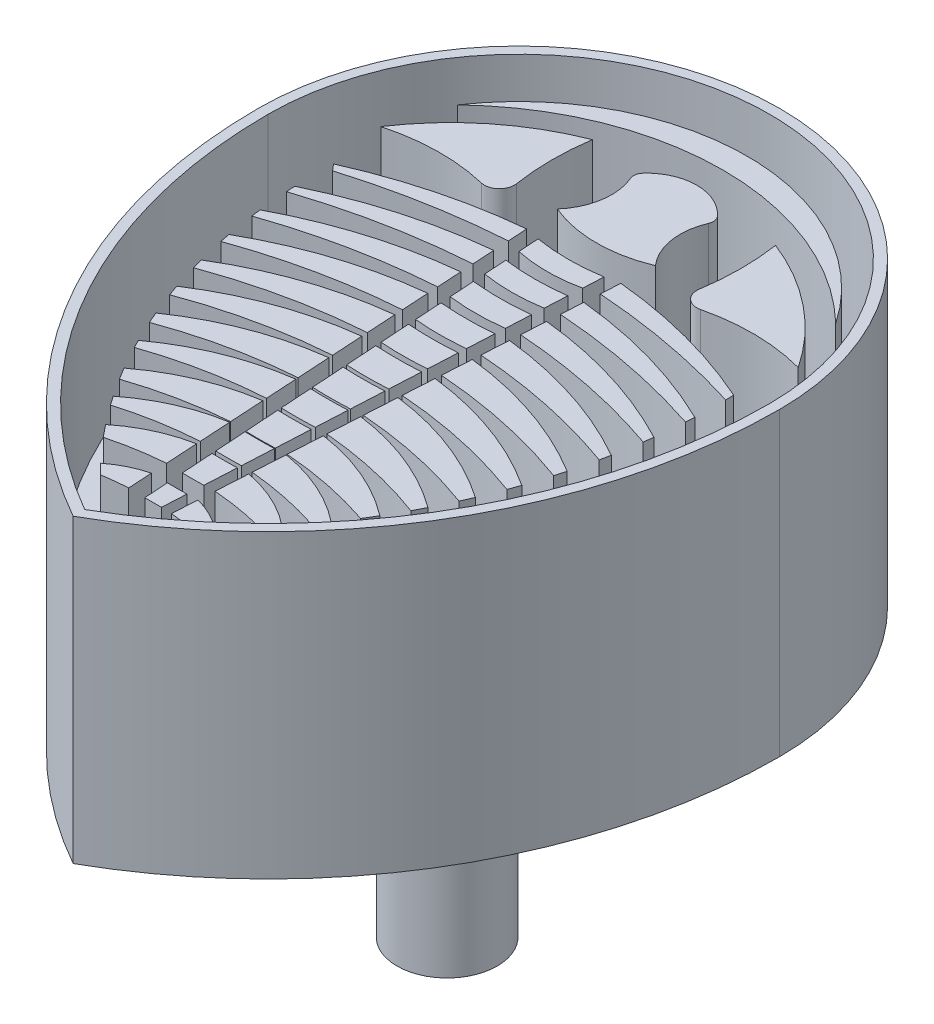
from build123d import *

# Parameters (mm, degrees)
P_IDAT_VYSUNUT_M1_DEPTH     = 3
P_IDAT_VYSUNUT_M2_DEPTH     = 2.5
VYSUNOUT_TENKOST_NN_1_DEPTH = 3
SKICA4_R                    = 1
P_IDAT_VYSUNUT_M3_DEPTH     = 5
M_TKO2_SCALE                = 10


with BuildPart() as part:
    # Skica1 → Přidat vysunutím1 (new body)
    with BuildSketch(Plane(origin=(0, 0, 0), x_dir=(1, 0, 0), z_dir=(0, 1, 0))):
        with BuildLine():
            ThreePointArc((5, 0), (0, 5), (-5, 0))
            ThreePointArc((-5, 0), (-3.660254038, -5), (0, -8.660254038))
            ThreePointArc((0, -8.660254038), (3.660254038, -5), (5, 0))
        make_face()
    extrude(amount=-P_IDAT_VYSUNUT_M1_DEPTH)

    # Skica2 → Přidat vysunutím2 (add)
    with BuildSketch(Plane(origin=(0, 0, 0), x_dir=(1, 0, 0), z_dir=(0, 1, 0))):
        with BuildLine():
            Line((-0.916308941, 0.705415762), (-0.939566009, 1.094601969))
            ThreePointArc((-0.939566009, 1.094601969), (-2.496070066, 0.816540474), (-3.987598771, 0.291787966))
            ThreePointArc((-3.987598771, 0.291787966), (-3.93376434, 0.226933977), (-3.878875249, 0.162970131))
            ThreePointArc((-3.878875249, 0.162970131), (-2.412884098, 0.517710206), (-0.916308941, 0.705415762))
        make_face()
        with BuildLine():
            ThreePointArc((3.996049018, 0.288019105), (2.500543522, 0.815361092), (0.939566009, 1.094601969))
            Line((0.939566009, 1.094601969), (0.916308941, 0.705415762))
            ThreePointArc((0.916308941, 0.705415762), (2.474795846, 0.50622373), (3.999244676, 0.125941382))
            ThreePointArc((3.999244676, 0.125941382), (3.997959641, 0.206986411), (3.996049018, 0.288019105))
        make_face()
        with BuildLine():
            Line((-0.435047938, -7.348056278), (-0.463870567, -6.865735387))
            ThreePointArc((-0.463870567, -6.865735387), (-0.820283032, -6.998144282), (-1.142178643, -7.200493427))
            ThreePointArc((-1.142178643, -7.200493427), (-1.044053725, -7.303235817), (-0.944547646, -7.404641136))
            ThreePointArc((-0.944547646, -7.404641136), (-0.69047942, -7.370211218), (-0.435047938, -7.348056278))
        make_face()
        with BuildLine():
            Line((-0.48311443, -6.543706568), (-0.52103385, -5.909159033))
            ThreePointArc((-0.52103385, -5.909159033), (-1.175976189, -6.119175526), (-1.759961506, -6.482517714))
            ThreePointArc((-1.759961506, -6.482517714), (-1.662000146, -6.605433643), (-1.56220985, -6.726869431))
            ThreePointArc((-1.56220985, -6.726869431), (-1.026754601, -6.611177456), (-0.48311443, -6.543706568))
        make_face()
        with BuildLine():
            ThreePointArc((1.759961506, -6.482517714), (1.175976189, -6.119175526), (0.52103385, -5.909159033))
            Line((0.52103385, -5.909159033), (0.48311443, -6.543706568))
            ThreePointArc((0.48311443, -6.543706568), (1.026754601, -6.611177456), (1.56220985, -6.726869431))
            ThreePointArc((1.56220985, -6.726869431), (1.662000146, -6.605433643), (1.759961506, -6.482517714))
        make_face()
        with BuildLine():
            Line((-0.525801188, -5.829381897), (-0.563062791, -5.205842323))
            ThreePointArc((-0.563062791, -5.205842323), (-1.413947855, -5.458574562), (-2.173892527, -5.917228103))
            ThreePointArc((-2.173892527, -5.917228103), (-2.111177401, -6.008129807), (-2.04750967, -6.098366866))
            ThreePointArc((-2.04750967, -6.098366866), (-1.294271561, -5.920788208), (-0.525801188, -5.829381897))
        make_face()
        with BuildLine():
            Line((-0.564221505, -5.186452286), (-0.605000226, -4.504056891))
            ThreePointArc((-0.605000226, -4.504056891), (-1.630072172, -4.78948348), (-2.550516325, -5.323359302))
            ThreePointArc((-2.550516325, -5.323359302), (-2.47902439, -5.443080103), (-2.405948876, -5.561840938))
            ThreePointArc((-2.405948876, -5.561840938), (-1.496899189, -5.31618491), (-0.564221505, -5.186452286))
        make_face()
        with BuildLine():
            ThreePointArc((2.550516325, -5.323359302), (1.630072172, -4.78948348), (0.605000226, -4.504056891))
            Line((0.605000226, -4.504056891), (0.564221505, -5.186452286))
            ThreePointArc((0.564221505, -5.186452286), (1.496899189, -5.31618491), (2.405948876, -5.561840938))
            ThreePointArc((2.405948876, -5.561840938), (2.47902439, -5.443080103), (2.550516325, -5.323359302))
        make_face()
        with BuildLine():
            ThreePointArc((2.888337343, -4.702033808), (1.82385638, -4.112337163), (0.646885649, -3.803141834))
            Line((0.646885649, -3.803141834), (0.608773859, -4.440908528))
            ThreePointArc((0.608773859, -4.440908528), (1.70684421, -4.611105365), (2.77208347, -4.927318553))
            ThreePointArc((2.77208347, -4.927318553), (2.83089034, -4.815027047), (2.888337343, -4.702033808))
        make_face()
        with BuildLine():
            Line((-0.609681174, -4.425725417), (-0.646885649, -3.803141834))
            ThreePointArc((-0.646885649, -3.803141834), (-1.82385638, -4.112337163), (-2.888337343, -4.702033808))
            ThreePointArc((-2.888337343, -4.702033808), (-2.846957116, -4.783763443), (-2.804865412, -4.865128946))
            ThreePointArc((-2.804865412, -4.865128946), (-1.722246967, -4.57062129), (-0.609681174, -4.425725417))
        make_face()
        with BuildLine():
            Line((-0.649768137, -3.75490598), (-0.688738665, -3.102769081))
            ThreePointArc((-0.688738665, -3.102769081), (-1.994758332, -3.427574113), (-3.185571439, -4.054590719))
            ThreePointArc((-3.185571439, -4.054590719), (-3.137074616, -4.168548051), (-3.087237062, -4.281925446))
            ThreePointArc((-3.087237062, -4.281925446), (-1.886992142, -3.932901443), (-0.649768137, -3.75490598))
        make_face()
        with BuildLine():
            ThreePointArc((3.185571439, -4.054590719), (1.994758332, -3.427574113), (0.688738665, -3.102769081))
            Line((0.688738665, -3.102769081), (0.649768137, -3.75490598))
            ThreePointArc((0.649768137, -3.75490598), (1.886992142, -3.932901443), (3.087237062, -4.281925446))
            ThreePointArc((3.087237062, -4.281925446), (3.137074616, -4.168548051), (3.185571439, -4.054590719))
        make_face()
        with BuildLine():
            ThreePointArc((3.440254888, -3.38250392), (2.142176753, -2.735637699), (0.730570119, -2.40275715))
            Line((0.730570119, -2.40275715), (0.693500935, -3.023076761))
            ThreePointArc((0.693500935, -3.023076761), (2.048697762, -3.217851436), (3.362758833, -3.602219899))
            ThreePointArc((3.362758833, -3.602219899), (3.402116283, -3.492576859), (3.440254888, -3.38250392))
        make_face()
        with BuildLine():
            Line((-0.693500935, -3.023076761), (-0.730570119, -2.40275715))
            ThreePointArc((-0.730570119, -2.40275715), (-2.142176753, -2.735637699), (-3.440254888, -3.38250392))
            ThreePointArc((-3.440254888, -3.38250392), (-3.402116283, -3.492576859), (-3.362758833, -3.602219899))
            ThreePointArc((-3.362758833, -3.602219899), (-2.048697762, -3.217851436), (-0.693500935, -3.023076761))
        make_face()
        with BuildLine():
            Line((-0.737644723, -2.28436999), (-0.772386499, -1.70299746))
            ThreePointArc((-0.772386499, -1.70299746), (-2.265442062, -2.036978997), (-3.650276137, -2.687358247))
            ThreePointArc((-3.650276137, -2.687358247), (-3.621750205, -2.792878944), (-3.592127328, -2.898096962))
            ThreePointArc((-3.592127328, -2.898096962), (-2.186526172, -2.490583797), (-0.737644723, -2.28436999))
        make_face()
        with BuildLine():
            ThreePointArc((3.650276137, -2.687358247), (2.265442062, -2.036978997), (0.772386499, -1.70299746))
            Line((0.772386499, -1.70299746), (0.737644723, -2.28436999))
            ThreePointArc((0.737644723, -2.28436999), (2.186526172, -2.490583797), (3.592127328, -2.898096962))
            ThreePointArc((3.592127328, -2.898096962), (3.621750205, -2.792878944), (3.650276137, -2.687358247))
        make_face()
        with BuildLine():
            ThreePointArc((3.813377604, -1.970848141), (2.363805986, -1.33206045), (0.814191928, -1.003421043))
            Line((0.814191928, -1.003421043), (0.782080688, -1.540773892))
            ThreePointArc((0.782080688, -1.540773892), (2.299279672, -1.75301782), (3.773049464, -2.17127951))
            ThreePointArc((3.773049464, -2.17127951), (3.793701377, -2.071161983), (3.813377604, -1.970848141))
        make_face()
        with BuildLine():
            Line((-0.782080688, -1.540773892), (-0.814191928, -1.003421043))
            ThreePointArc((-0.814191928, -1.003421043), (-2.363805986, -1.33206045), (-3.813377604, -1.970848141))
            ThreePointArc((-3.813377604, -1.970848141), (-3.793701377, -2.071161983), (-3.773049464, -2.17127951))
            ThreePointArc((-3.773049464, -2.17127951), (-2.299279672, -1.75301782), (-0.782080688, -1.540773892))
        make_face()
        with BuildLine():
            Line((-0.826716789, -0.793828702), (-0.855989148, -0.303981988))
            ThreePointArc((-0.855989148, -0.303981988), (-2.436429093, -0.621360254), (-3.927142449, -1.234787575))
            ThreePointArc((-3.927142449, -1.234787575), (-3.915520245, -1.329262214), (-3.903042076, -1.423627611))
            ThreePointArc((-3.903042076, -1.423627611), (-2.385752794, -1.006769816), (-0.826716789, -0.793828702))
        make_face()
        with BuildLine():
            ThreePointArc((3.927142449, -1.234787575), (2.436429093, -0.621360254), (0.855989148, -0.303981988))
            Line((0.855989148, -0.303981988), (0.826716789, -0.793828702))
            ThreePointArc((0.826716789, -0.793828702), (2.385752794, -1.006769816), (3.903042076, -1.423627611))
            ThreePointArc((3.903042076, -1.423627611), (3.915520245, -1.329262214), (3.927142449, -1.234787575))
        make_face()
        with BuildLine():
            ThreePointArc((3.988971171, -0.481127617), (2.482365461, 0.094622416), (0.897780057, 0.395351462))
            Line((0.897780057, 0.395351462), (0.871479662, -0.044762094))
            ThreePointArc((0.871479662, -0.044762094), (2.444698783, -0.253257558), (3.979415358, -0.657155804))
            ThreePointArc((3.979415358, -0.657155804), (3.984562694, -0.569161766), (3.988971171, -0.481127617))
        make_face()
        with BuildLine():
            Line((-0.871479662, -0.044762094), (-0.897780057, 0.395351462))
            ThreePointArc((-0.897780057, 0.395351462), (-2.482365461, 0.094622416), (-3.988971171, -0.481127617))
            ThreePointArc((-3.988971171, -0.481127617), (-3.984562694, -0.569161766), (-3.979415358, -0.657155804))
            ThreePointArc((-3.979415358, -0.657155804), (-2.444698783, -0.253257558), (-0.871479662, -0.044762094))
        make_face()
        with BuildLine():
            ThreePointArc((1.142178643, -7.200493427), (0.820283032, -6.998144282), (0.463870567, -6.865735387))
            Line((0.463870567, -6.865735387), (0.434044566, -7.364846815))
            ThreePointArc((0.434044566, -7.364846815), (0.674611597, -7.394792085), (0.913565558, -7.435660409))
            ThreePointArc((0.913565558, -7.435660409), (1.028790357, -7.318969583), (1.142178643, -7.200493427))
        make_face()
        with BuildLine():
            ThreePointArc((2.173892527, -5.917228103), (1.413947855, -5.458574562), (0.563062791, -5.205842323))
            Line((0.563062791, -5.205842323), (0.524857999, -5.84516532))
            ThreePointArc((0.524857999, -5.84516532), (1.275900679, -5.956649098), (2.009972467, -6.150639692))
            ThreePointArc((2.009972467, -6.150639692), (2.092725079, -6.034490511), (2.173892527, -5.917228103))
        make_face()
        with BuildLine():
            ThreePointArc((0.662066926, 1.038108349), (0.004161666, 0.983172801), (-0.653856014, 1.036744977))
            Line((-0.653856014, 1.036744977), (-0.627177875, 0.627948759))
            ThreePointArc((-0.627177875, 0.627948759), (0.007047348, 0.561342071), (0.640951077, 0.630941981))
            Line((0.640951077, 0.630941981), (0.662066926, 1.038108349))
        make_face()
        with BuildLine():
            ThreePointArc((0.626415299, 0.350655846), (0.008819368, 0.30865484), (-0.608930115, 0.348333492))
            Line((-0.608930115, 0.348333492), (-0.579458539, -0.103267301))
            ThreePointArc((-0.579458539, -0.103267301), (0.011961322, -0.148953749), (0.60307309, -0.099440312))
            Line((0.60307309, -0.099440312), (0.626415299, 0.350655846))
        make_face()
        with BuildLine():
            Line((0.56489573, -0.835595287), (0.590594924, -0.34005056))
            ThreePointArc((0.590594924, -0.34005056), (0.013466822, -0.372593507), (-0.563817169, -0.342944183))
            Line((-0.563817169, -0.342944183), (-0.531393318, -0.839783468))
            ThreePointArc((-0.531393318, -0.839783468), (0.016881591, -0.871818687), (0.56489573, -0.835595287))
        make_face()
        with BuildLine():
            Line((0.526626446, -1.573522766), (0.554661515, -1.032936542))
            ThreePointArc((0.554661515, -1.032936542), (0.018112597, -1.058353296), (-0.518578705, -1.036145198))
            Line((-0.518578705, -1.036145198), (-0.483230171, -1.577800173))
            ThreePointArc((-0.483230171, -1.577800173), (0.021803285, -1.600485761), (0.526626446, -1.573522766))
        make_face()
        with BuildLine():
            ThreePointArc((0.518646873, -1.727388889), (0.022760192, -1.747313378), (-0.473249622, -1.730734777))
            Line((-0.473249622, -1.730734777), (-0.435139253, -2.3147101))
            ThreePointArc((-0.435139253, -2.3147101), (0.026715844, -2.330778107), (0.488405798, -2.310512426))
            Line((0.488405798, -2.310512426), (0.518646873, -1.727388889))
        make_face()
        with BuildLine():
            ThreePointArc((0.482569539, -2.423050098), (0.027411133, -2.438668883), (-0.42785002, -2.42640495))
            Line((-0.42785002, -2.42640495), (-0.387270501, -3.048215708))
            ThreePointArc((-0.387270501, -3.048215708), (0.031606302, -3.059500446), (0.45035596, -3.044208443))
            Line((0.45035596, -3.044208443), (0.482569539, -2.423050098))
        make_face()
        with BuildLine():
            ThreePointArc((0.410261069, -3.817338207), (0.036726185, -3.826801141), (-0.336874511, -3.820446857))
            Line((-0.336874511, -3.820446857), (-0.296212988, -4.443514195))
            ThreePointArc((-0.296212988, -4.443514195), (0.040912963, -4.448897986), (0.377966169, -4.440064623))
            Line((0.377966169, -4.440064623), (0.410261069, -3.817338207))
        make_face()
        with BuildLine():
            Line((0.412605163, -3.77213821), (0.446439681, -3.119724092))
            ThreePointArc((0.446439681, -3.119724092), (0.032066228, -3.131924709), (-0.382390558, -3.122992379))
            Line((-0.382390558, -3.122992379), (-0.339782943, -3.775880184))
            ThreePointArc((-0.339782943, -3.775880184), (0.036459149, -3.783668202), (0.412605163, -3.77213821))
        make_face()
        with BuildLine():
            Line((0.305409141, -5.839145549), (0.337737111, -5.215781462))
            ThreePointArc((0.337737111, -5.215781462), (0.046065788, -5.221258982), (-0.245643058, -5.218410675))
            Line((-0.245643058, -5.218410675), (-0.20495555, -5.841876176))
            ThreePointArc((-0.20495555, -5.841876176), (0.050245349, -5.843978529), (0.305409141, -5.839145549))
        make_face()
        with BuildLine():
            Line((0.338653865, -5.198104154), (0.374030936, -4.51594575))
            ThreePointArc((0.374030936, -4.51594575), (0.041392047, -4.523203734), (-0.291297367, -4.51883756))
            Line((-0.291297367, -4.51883756), (-0.246767591, -5.20117915))
            ThreePointArc((-0.246767591, -5.20117915), (0.045968856, -5.204538098), (0.338653865, -5.198104154))
        make_face()
        with BuildLine():
            ThreePointArc((0.301348943, -5.917436324), (0.050751597, -5.92147661), (-0.199872475, -5.919765477))
            Line((-0.199872475, -5.919765477), (-0.158480757, -6.55402178))
            ThreePointArc((-0.158480757, -6.55402178), (0.054999827, -6.555115225), (0.268455851, -6.551697388))
            Line((0.268455851, -6.551697388), (0.301348943, -5.917436324))
        make_face()
        with BuildLine():
            ThreePointArc((0.251838147, -6.872128272), (0.057127362, -6.874661622), (-0.137598784, -6.8740018))
            Line((-0.137598784, -6.8740018), (-0.106128968, -7.356222162))
            ThreePointArc((-0.106128968, -7.356222162), (0.060356742, -7.356571612), (0.226828381, -7.354379088))
            Line((0.226828381, -7.354379088), (0.251838147, -6.872128272))
        make_face()
        with BuildLine():
            ThreePointArc((-3.772330851, 2.547069838), (0, 4.070537807), (3.772330851, 2.547069838))
            ThreePointArc((3.772330851, 2.547069838), (0, 4.5517079), (-3.772330851, 2.547069838))
        make_face()
        with BuildLine():
            ThreePointArc((-1.822084639, 1.775573316), (-1.881947184, 2.534148909), (-1.826006026, 3.293023761))
            ThreePointArc((-1.826006026, 3.293023761), (-3.13913069, 2.530148747), (-4.162667451, 1.408254291))
            ThreePointArc((-4.162667451, 1.408254291), (-3.177280617, 1.546631075), (-2.188227529, 1.437501174))
            ThreePointArc((-2.188227529, 1.437501174), (-1.914977273, 1.508870723), (-1.822084639, 1.775573316))
        make_face()
        with BuildLine():
            ThreePointArc((2.188227529, 1.437501174), (3.177280617, 1.546631075), (4.162667451, 1.408254291))
            ThreePointArc((4.162667451, 1.408254291), (3.13913069, 2.530148747), (1.826006026, 3.293023761))
            ThreePointArc((1.826006026, 3.293023761), (1.881947184, 2.534148909), (1.822084639, 1.775573316))
            ThreePointArc((1.822084639, 1.775573316), (1.914977273, 1.508870723), (2.188227529, 1.437501174))
        make_face()
        with BuildLine():
            ThreePointArc((-0.777989506, 3.004550275), (-0.696842448, 2.345663458), (-0.978400549, 1.744463226))
            ThreePointArc((-0.978400549, 1.744463226), (0, 1.547069838), (0.978400549, 1.744463226))
            ThreePointArc((0.978400549, 1.744463226), (0.696842448, 2.345663458), (0.777989506, 3.004550275))
            ThreePointArc((0.777989506, 3.004550275), (0.791260451, 3.115919535), (0.7424957, 3.216920669))
            ThreePointArc((0.7424957, 3.216920669), (0, 3.547069838), (-0.7424957, 3.216920669))
            ThreePointArc((-0.7424957, 3.216920669), (-0.791260451, 3.115919535), (-0.777989506, 3.004550275))
        make_face()
    extrude(amount=P_IDAT_VYSUNUT_M2_DEPTH)



with BuildPart() as body_2:
    # Skica1<2> → Vysunout tenkostěnný1 (new, symmetric)
    with BuildSketch(Plane(origin=(0, 0, 0), x_dir=(1, 0, 0), z_dir=(0, 1, 0))):
        with BuildLine():
            ThreePointArc((5.2, 0), (0, 5.2), (-5.2, 0))
            ThreePointArc((-5.2, 0), (-3.804544281, -5.149757276), (0, -8.890444308))
            ThreePointArc((0, -8.890444308), (3.804544281, -5.149757276), (5.2, 0))
        make_face()
        with BuildLine():
            ThreePointArc((5, 0), (0, 5), (-5, 0))
            ThreePointArc((-5, 0), (-3.660254038, -5), (0, -8.660254038))
            ThreePointArc((0, -8.660254038), (3.660254038, -5), (5, 0))
        make_face(mode=Mode.SUBTRACT)
    extrude(amount=VYSUNOUT_TENKOST_NN_1_DEPTH, both=True)


with BuildPart() as part_1:
    add(part.part)

    add(body_2.part)  # Přidat vysunutím3 merges body 2
    # Skica4 → Přidat vysunutím3 (add)
    with BuildSketch(Plane(origin=(0, -3, 0), x_dir=(-1, 0, 0), z_dir=(0, -1, 0))):
        with Locations((0, -1.431655115)):
            Circle(SKICA4_R)
    extrude(amount=P_IDAT_VYSUNUT_M3_DEPTH)


with BuildPart() as part_2:
    # Měřítko2: scaled about (0, 0, 0)
    add(part_1.part.scale(M_TKO2_SCALE))


solid = part_2.part
